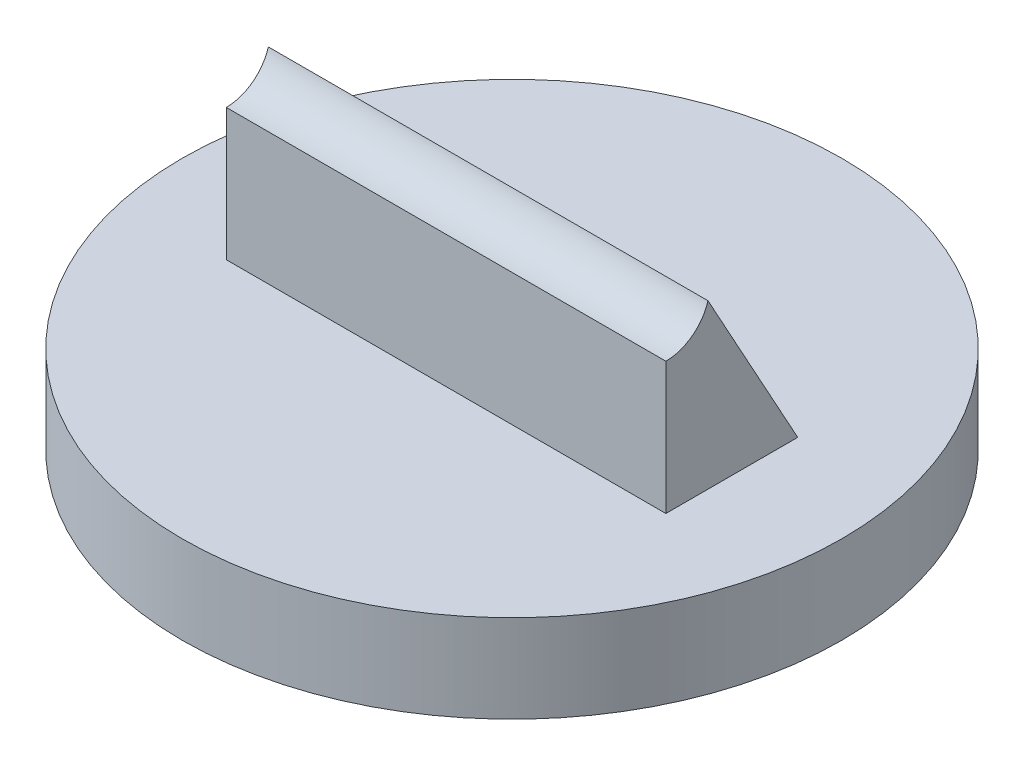
from build123d import *

# Parameters (mm, degrees)
SKIZZE1_R                       = 75
AUFSATZ_LINEAR_AUSTRAGEN1_DEPTH = 20
SKIZZE2_W                       = 100
SKIZZE2_H                       = 30
AUFSATZ_LINEAR_AUSTRAGEN2_DEPTH = 40
SKIZZE3_R                       = 10
SCHNITT_LINEAR_AUSTRAGEN2_DEPTH = 100
SCHNITT_LINEAR_AUSTRAGEN3_DEPTH = 100


with BuildPart() as part:
    # Skizze1 → Aufsatz-Linear austragen1 (new body)
    with BuildSketch(Plane(origin=(0, 0, 0), x_dir=(1, 0, 0), z_dir=(0, 1, 0))):
        Circle(SKIZZE1_R)
    extrude(amount=AUFSATZ_LINEAR_AUSTRAGEN1_DEPTH)

    # Skizze2 → Aufsatz-Linear austragen2 (add)
    with BuildSketch(Plane(origin=(0, 20, 0), x_dir=(1, 0, 0), z_dir=(0, 1, 0))):
        Rectangle(SKIZZE2_W, SKIZZE2_H)
    extrude(amount=AUFSATZ_LINEAR_AUSTRAGEN2_DEPTH)

    # Skizze3 → Schnitt-Linear austragen2 (cut)
    with BuildSketch(Plane(origin=(50, 0, 0), x_dir=(0, 0, -1), z_dir=(1, 0, 0))):
        with Locations((-15, 60)):
            Circle(SKIZZE3_R)
    extrude(amount=-SCHNITT_LINEAR_AUSTRAGEN2_DEPTH, mode=Mode.SUBTRACT)

    # Skizze4 → Schnitt-Linear austragen3 (cut)
    with BuildSketch(Plane(origin=(50, 0, 0), x_dir=(0, 0, -1), z_dir=(1, 0, 0))):
        Polygon((15, 20), (15, 60), (-7, 60), align=None)
    extrude(amount=-SCHNITT_LINEAR_AUSTRAGEN3_DEPTH, mode=Mode.SUBTRACT)


solid = part.part
